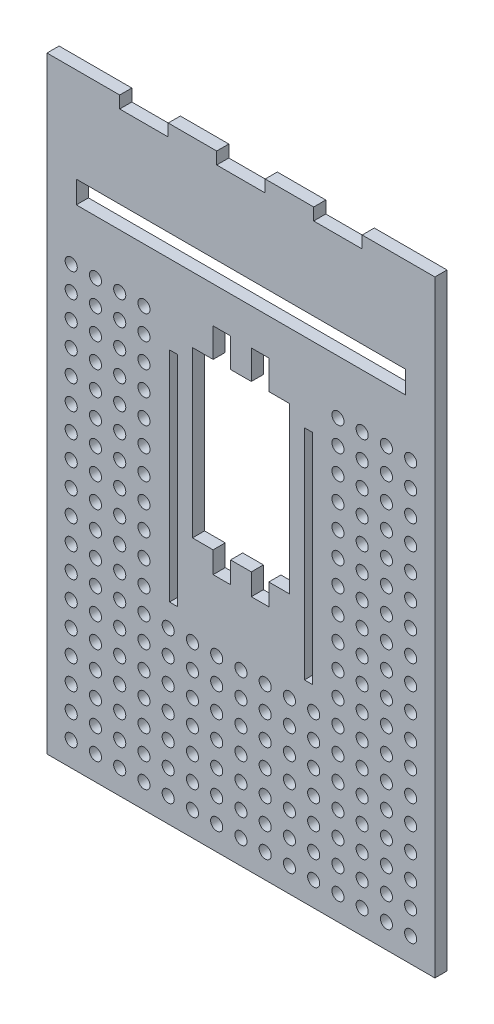
from build123d import *

# Parameters (mm, degrees)
SKETCH1_W           = 101.6
SKETCH1_H           = 159.004
BOSS_EXTRUDE1_DEPTH = 3.175
CUT_EXTRUDE1_REACH  = 96.4
SKETCH3_W           = 25.4
SKETCH3_H           = 43.18
CUT_EXTRUDE2_REACH  = 96.4
SKETCH4_W           = 12.7
SKETCH4_H           = 3.175
CUT_EXTRUDE3_REACH  = 96.4
SKETCH5_W           = 4.572
SKETCH5_H           = 7.62
SKETCH5_H_2         = 5.627437874
CUT_EXTRUDE4_REACH  = 96.4
SKETCH6_W           = 86.234169996
SKETCH6_H           = 5.842
CUT_EXTRUDE5_REACH  = 96.4
SKETCH8_W           = 2.0828
SKETCH8_H           = 57.198896488
SKETCH9_R           = 1.5875
CUT_EXTRUDE6_DEPTH  = 3.175


with BuildPart() as part:
    # Sketch1 → Boss-Extrude1 (new body)
    with BuildSketch(Plane.XY):
        Rectangle(SKETCH1_W, SKETCH1_H)
    extrude(amount=BOSS_EXTRUDE1_DEPTH)

    # Sketch3 → Cut-Extrude1 (cut, up to next)
    with BuildSketch(Plane.XY.offset(3.175), mode=Mode.PRIVATE) as cut_extrude1_sk1:
        with Locations((0, 10.16)):
            Rectangle(SKETCH3_W, SKETCH3_H)
    cut_extrude1_tool1 = extrude(cut_extrude1_sk1.sketch, amount=-CUT_EXTRUDE1_REACH, mode=Mode.PRIVATE) & part.part
    add(cut_extrude1_tool1.solids().sort_by_distance((0, 10.16, 3.175))[0], mode=Mode.SUBTRACT)

    # Sketch4 → Cut-Extrude2 (cut, up to next)
    with BuildSketch(Plane.XY.offset(3.175), mode=Mode.PRIVATE) as cut_extrude2_sk1:
        with Locations((0, 77.9145)):
            Rectangle(SKETCH4_W, SKETCH4_H)
    cut_extrude2_tool1 = extrude(cut_extrude2_sk1.sketch, amount=-CUT_EXTRUDE2_REACH, mode=Mode.PRIVATE) & part.part
    # Sketch4 → Cut-Extrude2 (cut, up to next)
    with BuildSketch(Plane.XY.offset(3.175), mode=Mode.PRIVATE) as cut_extrude2_sk2:
        with Locations((25.4, 77.9145)):
            Rectangle(SKETCH4_W, SKETCH4_H)
    cut_extrude2_tool2 = extrude(cut_extrude2_sk2.sketch, amount=-CUT_EXTRUDE2_REACH, mode=Mode.PRIVATE) & part.part
    # Sketch4 → Cut-Extrude2 (cut, up to next)
    with BuildSketch(Plane.XY.offset(3.175), mode=Mode.PRIVATE) as cut_extrude2_sk3:
        with Locations((-25.4, 77.9145)):
            Rectangle(SKETCH4_W, SKETCH4_H)
    cut_extrude2_tool3 = extrude(cut_extrude2_sk3.sketch, amount=-CUT_EXTRUDE2_REACH, mode=Mode.PRIVATE) & part.part
    add(cut_extrude2_tool1.solids().sort_by_distance((0, 77.9145, 3.175))[0], mode=Mode.SUBTRACT)
    add(cut_extrude2_tool2.solids().sort_by_distance((25.4, 77.9145, 3.175))[0], mode=Mode.SUBTRACT)
    add(cut_extrude2_tool3.solids().sort_by_distance((-25.4, 77.9145, 3.175))[0], mode=Mode.SUBTRACT)

    # Sketch5 → Cut-Extrude3 (cut, up to next)
    with BuildSketch(Plane.XY.offset(3.175), mode=Mode.PRIVATE) as cut_extrude3_sk1:
        with Locations((-5.000000218, 35.56)):
            Rectangle(SKETCH5_W, SKETCH5_H)
    cut_extrude3_tool1 = extrude(cut_extrude3_sk1.sketch, amount=-CUT_EXTRUDE3_REACH, mode=Mode.PRIVATE) & part.part
    # Sketch5 → Cut-Extrude3 (cut, up to next)
    with BuildSketch(Plane.XY.offset(3.175), mode=Mode.PRIVATE) as cut_extrude3_sk2:
        with Locations((5.000000218, 35.56)):
            Rectangle(SKETCH5_W, SKETCH5_H)
    cut_extrude3_tool2 = extrude(cut_extrude3_sk2.sketch, amount=-CUT_EXTRUDE3_REACH, mode=Mode.PRIVATE) & part.part
    # Sketch5 → Cut-Extrude3 (cut, up to next)
    with BuildSketch(Plane.XY.offset(3.175), mode=Mode.PRIVATE) as cut_extrude3_sk3:
        with Locations((-5.000000218, -14.243718937)):
            Rectangle(SKETCH5_W, SKETCH5_H_2)
    cut_extrude3_tool3 = extrude(cut_extrude3_sk3.sketch, amount=-CUT_EXTRUDE3_REACH, mode=Mode.PRIVATE) & part.part
    # Sketch5 → Cut-Extrude3 (cut, up to next)
    with BuildSketch(Plane.XY.offset(3.175), mode=Mode.PRIVATE) as cut_extrude3_sk4:
        with Locations((5.000000218, -14.243718937)):
            Rectangle(SKETCH5_W, SKETCH5_H_2)
    cut_extrude3_tool4 = extrude(cut_extrude3_sk4.sketch, amount=-CUT_EXTRUDE3_REACH, mode=Mode.PRIVATE) & part.part
    add(cut_extrude3_tool1.solids().sort_by_distance((-5, 35.56, 3.175))[0], mode=Mode.SUBTRACT)
    add(cut_extrude3_tool2.solids().sort_by_distance((5, 35.56, 3.175))[0], mode=Mode.SUBTRACT)
    add(cut_extrude3_tool3.solids().sort_by_distance((-5, -14.243719, 3.175))[0], mode=Mode.SUBTRACT)
    add(cut_extrude3_tool4.solids().sort_by_distance((5, -14.243719, 3.175))[0], mode=Mode.SUBTRACT)

    # Sketch6 → Cut-Extrude4 (cut, up to next)
    with BuildSketch(Plane.XY.offset(3.175), mode=Mode.PRIVATE) as cut_extrude4_sk1:
        with Locations((0, 51.816)):
            Rectangle(SKETCH6_W, SKETCH6_H)
    cut_extrude4_tool1 = extrude(cut_extrude4_sk1.sketch, amount=-CUT_EXTRUDE4_REACH, mode=Mode.PRIVATE) & part.part
    add(cut_extrude4_tool1.solids().sort_by_distance((0, 51.816, 3.175))[0], mode=Mode.SUBTRACT)

    # Sketch8 → Cut-Extrude5 (cut, up to next)
    with BuildSketch(Plane.XY.offset(3.175), mode=Mode.PRIVATE) as cut_extrude5_sk1:
        with Locations((-17.665411222, -0.377226022)):
            Rectangle(SKETCH8_W, SKETCH8_H)
    cut_extrude5_tool1 = extrude(cut_extrude5_sk1.sketch, amount=-CUT_EXTRUDE5_REACH, mode=Mode.PRIVATE) & part.part
    # Sketch8 → Cut-Extrude5 (cut, up to next)
    with BuildSketch(Plane.XY.offset(3.175), mode=Mode.PRIVATE) as cut_extrude5_sk2:
        with Locations((17.665411222, -0.377226022)):
            Rectangle(SKETCH8_W, SKETCH8_H)
    cut_extrude5_tool2 = extrude(cut_extrude5_sk2.sketch, amount=-CUT_EXTRUDE5_REACH, mode=Mode.PRIVATE) & part.part
    add(cut_extrude5_tool1.solids().sort_by_distance((-17.665411, -0.377226, 3.175))[0], mode=Mode.SUBTRACT)
    add(cut_extrude5_tool2.solids().sort_by_distance((17.665411, -0.377226, 3.175))[0], mode=Mode.SUBTRACT)

    # Sketch9 → Cut-Extrude6 (cut)
    with BuildSketch(Plane.XY.offset(3.175)):
        with Locations((-44.45, -73.152)):
            Circle(SKETCH9_R)
        with Locations((-38.1, -73.152)):
            Circle(SKETCH9_R)
        with Locations((-31.75, -73.152)):
            Circle(SKETCH9_R)
        with Locations((-25.4, -73.152)):
            Circle(SKETCH9_R)
        with Locations((-19.05, -73.152)):
            Circle(SKETCH9_R)
        with Locations((-12.7, -73.152)):
            Circle(SKETCH9_R)
        with Locations((-6.35, -73.152)):
            Circle(SKETCH9_R)
        with Locations((0, -73.152)):
            Circle(SKETCH9_R)
        with Locations((6.35, -73.152)):
            Circle(SKETCH9_R)
        with Locations((12.7, -73.152)):
            Circle(SKETCH9_R)
        with Locations((19.05, -73.152)):
            Circle(SKETCH9_R)
        with Locations((25.4, -73.152)):
            Circle(SKETCH9_R)
        with Locations((31.75, -73.152)):
            Circle(SKETCH9_R)
        with Locations((38.1, -73.152)):
            Circle(SKETCH9_R)
        with Locations((44.45, -73.152)):
            Circle(SKETCH9_R)
        with Locations((-38.1, -66.802)):
            Circle(SKETCH9_R)
        with Locations((-31.75, -66.802)):
            Circle(SKETCH9_R)
        with Locations((-25.4, -66.802)):
            Circle(SKETCH9_R)
        with Locations((-19.05, -66.802)):
            Circle(SKETCH9_R)
        with Locations((-12.7, -66.802)):
            Circle(SKETCH9_R)
        with Locations((-6.35, -66.802)):
            Circle(SKETCH9_R)
        with Locations((0, -66.802)):
            Circle(SKETCH9_R)
        with Locations((6.35, -66.802)):
            Circle(SKETCH9_R)
        with Locations((12.7, -66.802)):
            Circle(SKETCH9_R)
        with Locations((19.05, -66.802)):
            Circle(SKETCH9_R)
        with Locations((25.4, -66.802)):
            Circle(SKETCH9_R)
        with Locations((31.75, -66.802)):
            Circle(SKETCH9_R)
        with Locations((38.1, -66.802)):
            Circle(SKETCH9_R)
        with Locations((44.45, -66.802)):
            Circle(SKETCH9_R)
        with Locations((-38.1, -60.452)):
            Circle(SKETCH9_R)
        with Locations((-31.75, -60.452)):
            Circle(SKETCH9_R)
        with Locations((-25.4, -60.452)):
            Circle(SKETCH9_R)
        with Locations((-19.05, -60.452)):
            Circle(SKETCH9_R)
        with Locations((-12.7, -60.452)):
            Circle(SKETCH9_R)
        with Locations((-6.35, -60.452)):
            Circle(SKETCH9_R)
        with Locations((0, -60.452)):
            Circle(SKETCH9_R)
        with Locations((6.35, -60.452)):
            Circle(SKETCH9_R)
        with Locations((12.7, -60.452)):
            Circle(SKETCH9_R)
        with Locations((19.05, -60.452)):
            Circle(SKETCH9_R)
        with Locations((25.4, -60.452)):
            Circle(SKETCH9_R)
        with Locations((31.75, -60.452)):
            Circle(SKETCH9_R)
        with Locations((38.1, -60.452)):
            Circle(SKETCH9_R)
        with Locations((44.45, -60.452)):
            Circle(SKETCH9_R)
        with Locations((-38.1, -54.102)):
            Circle(SKETCH9_R)
        with Locations((-31.75, -54.102)):
            Circle(SKETCH9_R)
        with Locations((-25.4, -54.102)):
            Circle(SKETCH9_R)
        with Locations((-19.05, -54.102)):
            Circle(SKETCH9_R)
        with Locations((-12.7, -54.102)):
            Circle(SKETCH9_R)
        with Locations((-6.35, -54.102)):
            Circle(SKETCH9_R)
        with Locations((0, -54.102)):
            Circle(SKETCH9_R)
        with Locations((6.35, -54.102)):
            Circle(SKETCH9_R)
        with Locations((12.7, -54.102)):
            Circle(SKETCH9_R)
        with Locations((19.05, -54.102)):
            Circle(SKETCH9_R)
        with Locations((25.4, -54.102)):
            Circle(SKETCH9_R)
        with Locations((31.75, -54.102)):
            Circle(SKETCH9_R)
        with Locations((38.1, -54.102)):
            Circle(SKETCH9_R)
        with Locations((44.45, -54.102)):
            Circle(SKETCH9_R)
        with Locations((-38.1, -47.752)):
            Circle(SKETCH9_R)
        with Locations((-31.75, -47.752)):
            Circle(SKETCH9_R)
        with Locations((-25.4, -47.752)):
            Circle(SKETCH9_R)
        with Locations((-19.05, -47.752)):
            Circle(SKETCH9_R)
        with Locations((-12.7, -47.752)):
            Circle(SKETCH9_R)
        with Locations((-6.35, -47.752)):
            Circle(SKETCH9_R)
        with Locations((0, -47.752)):
            Circle(SKETCH9_R)
        with Locations((6.35, -47.752)):
            Circle(SKETCH9_R)
        with Locations((12.7, -47.752)):
            Circle(SKETCH9_R)
        with Locations((19.05, -47.752)):
            Circle(SKETCH9_R)
        with Locations((25.4, -47.752)):
            Circle(SKETCH9_R)
        with Locations((31.75, -47.752)):
            Circle(SKETCH9_R)
        with Locations((38.1, -47.752)):
            Circle(SKETCH9_R)
        with Locations((44.45, -47.752)):
            Circle(SKETCH9_R)
        with Locations((-38.1, -41.402)):
            Circle(SKETCH9_R)
        with Locations((-31.75, -41.402)):
            Circle(SKETCH9_R)
        with Locations((-25.4, -41.402)):
            Circle(SKETCH9_R)
        with Locations((-19.05, -41.402)):
            Circle(SKETCH9_R)
        with Locations((-12.7, -41.402)):
            Circle(SKETCH9_R)
        with Locations((-6.35, -41.402)):
            Circle(SKETCH9_R)
        with Locations((0, -41.402)):
            Circle(SKETCH9_R)
        with Locations((6.35, -41.402)):
            Circle(SKETCH9_R)
        with Locations((12.7, -41.402)):
            Circle(SKETCH9_R)
        with Locations((19.05, -41.402)):
            Circle(SKETCH9_R)
        with Locations((25.4, -41.402)):
            Circle(SKETCH9_R)
        with Locations((31.75, -41.402)):
            Circle(SKETCH9_R)
        with Locations((38.1, -41.402)):
            Circle(SKETCH9_R)
        with Locations((44.45, -41.402)):
            Circle(SKETCH9_R)
        with Locations((-38.1, -35.052)):
            Circle(SKETCH9_R)
        with Locations((-31.75, -35.052)):
            Circle(SKETCH9_R)
        with Locations((-25.4, -35.052)):
            Circle(SKETCH9_R)
        with Locations((-19.05, -35.052)):
            Circle(SKETCH9_R)
        with Locations((-12.7, -35.052)):
            Circle(SKETCH9_R)
        with Locations((-6.35, -35.052)):
            Circle(SKETCH9_R)
        with Locations((0, -35.052)):
            Circle(SKETCH9_R)
        with Locations((6.35, -35.052)):
            Circle(SKETCH9_R)
        with Locations((12.7, -35.052)):
            Circle(SKETCH9_R)
        with Locations((19.05, -35.052)):
            Circle(SKETCH9_R)
        with Locations((25.4, -35.052)):
            Circle(SKETCH9_R)
        with Locations((31.75, -35.052)):
            Circle(SKETCH9_R)
        with Locations((38.1, -35.052)):
            Circle(SKETCH9_R)
        with Locations((44.45, -35.052)):
            Circle(SKETCH9_R)
        with Locations((-44.45, -66.802)):
            Circle(SKETCH9_R)
        with Locations((-44.45, -60.452)):
            Circle(SKETCH9_R)
        with Locations((-44.45, -54.102)):
            Circle(SKETCH9_R)
        with Locations((-44.45, -47.752)):
            Circle(SKETCH9_R)
        with Locations((-44.45, -41.402)):
            Circle(SKETCH9_R)
        with Locations((-44.45, -35.052)):
            Circle(SKETCH9_R)
        with Locations((-44.45, -28.702)):
            Circle(SKETCH9_R)
        with Locations((-38.1, -28.702)):
            Circle(SKETCH9_R)
        with Locations((-31.75, -28.702)):
            Circle(SKETCH9_R)
        with Locations((-25.4, -28.702)):
            Circle(SKETCH9_R)
        with Locations((25.4, -28.702)):
            Circle(SKETCH9_R)
        with Locations((31.75, -28.702)):
            Circle(SKETCH9_R)
        with Locations((38.1, -28.702)):
            Circle(SKETCH9_R)
        with Locations((44.45, -28.702)):
            Circle(SKETCH9_R)
        with Locations((-44.45, -22.352)):
            Circle(SKETCH9_R)
        with Locations((-38.1, -22.352)):
            Circle(SKETCH9_R)
        with Locations((-31.75, -22.352)):
            Circle(SKETCH9_R)
        with Locations((-25.4, -22.352)):
            Circle(SKETCH9_R)
        with Locations((25.4, -22.352)):
            Circle(SKETCH9_R)
        with Locations((31.75, -22.352)):
            Circle(SKETCH9_R)
        with Locations((38.1, -22.352)):
            Circle(SKETCH9_R)
        with Locations((44.45, -22.352)):
            Circle(SKETCH9_R)
        with Locations((-44.45, -16.002)):
            Circle(SKETCH9_R)
        with Locations((-38.1, -16.002)):
            Circle(SKETCH9_R)
        with Locations((-31.75, -16.002)):
            Circle(SKETCH9_R)
        with Locations((-25.4, -16.002)):
            Circle(SKETCH9_R)
        with Locations((25.4, -16.002)):
            Circle(SKETCH9_R)
        with Locations((31.75, -16.002)):
            Circle(SKETCH9_R)
        with Locations((38.1, -16.002)):
            Circle(SKETCH9_R)
        with Locations((44.45, -16.002)):
            Circle(SKETCH9_R)
        with Locations((-44.45, -9.652)):
            Circle(SKETCH9_R)
        with Locations((-38.1, -9.652)):
            Circle(SKETCH9_R)
        with Locations((-31.75, -9.652)):
            Circle(SKETCH9_R)
        with Locations((-25.4, -9.652)):
            Circle(SKETCH9_R)
        with Locations((25.4, -9.652)):
            Circle(SKETCH9_R)
        with Locations((31.75, -9.652)):
            Circle(SKETCH9_R)
        with Locations((38.1, -9.652)):
            Circle(SKETCH9_R)
        with Locations((44.45, -9.652)):
            Circle(SKETCH9_R)
        with Locations((-44.45, -3.302)):
            Circle(SKETCH9_R)
        with Locations((-38.1, -3.302)):
            Circle(SKETCH9_R)
        with Locations((-31.75, -3.302)):
            Circle(SKETCH9_R)
        with Locations((-25.4, -3.302)):
            Circle(SKETCH9_R)
        with Locations((25.4, -3.302)):
            Circle(SKETCH9_R)
        with Locations((31.75, -3.302)):
            Circle(SKETCH9_R)
        with Locations((38.1, -3.302)):
            Circle(SKETCH9_R)
        with Locations((44.45, -3.302)):
            Circle(SKETCH9_R)
        with Locations((-44.45, 3.048)):
            Circle(SKETCH9_R)
        with Locations((-38.1, 3.048)):
            Circle(SKETCH9_R)
        with Locations((-31.75, 3.048)):
            Circle(SKETCH9_R)
        with Locations((-25.4, 3.048)):
            Circle(SKETCH9_R)
        with Locations((25.4, 3.048)):
            Circle(SKETCH9_R)
        with Locations((31.75, 3.048)):
            Circle(SKETCH9_R)
        with Locations((38.1, 3.048)):
            Circle(SKETCH9_R)
        with Locations((44.45, 3.048)):
            Circle(SKETCH9_R)
        with Locations((-44.45, 9.398)):
            Circle(SKETCH9_R)
        with Locations((-38.1, 9.398)):
            Circle(SKETCH9_R)
        with Locations((-31.75, 9.398)):
            Circle(SKETCH9_R)
        with Locations((-25.4, 9.398)):
            Circle(SKETCH9_R)
        with Locations((25.4, 9.398)):
            Circle(SKETCH9_R)
        with Locations((31.75, 9.398)):
            Circle(SKETCH9_R)
        with Locations((38.1, 9.398)):
            Circle(SKETCH9_R)
        with Locations((44.45, 9.398)):
            Circle(SKETCH9_R)
        with Locations((-44.45, 15.748)):
            Circle(SKETCH9_R)
        with Locations((-38.1, 15.748)):
            Circle(SKETCH9_R)
        with Locations((-31.75, 15.748)):
            Circle(SKETCH9_R)
        with Locations((-25.4, 15.748)):
            Circle(SKETCH9_R)
        with Locations((25.4, 15.748)):
            Circle(SKETCH9_R)
        with Locations((31.75, 15.748)):
            Circle(SKETCH9_R)
        with Locations((38.1, 15.748)):
            Circle(SKETCH9_R)
        with Locations((44.45, 15.748)):
            Circle(SKETCH9_R)
        with Locations((-44.45, 22.098)):
            Circle(SKETCH9_R)
        with Locations((-38.1, 22.098)):
            Circle(SKETCH9_R)
        with Locations((-31.75, 22.098)):
            Circle(SKETCH9_R)
        with Locations((-25.4, 22.098)):
            Circle(SKETCH9_R)
        with Locations((25.4, 22.098)):
            Circle(SKETCH9_R)
        with Locations((31.75, 22.098)):
            Circle(SKETCH9_R)
        with Locations((38.1, 22.098)):
            Circle(SKETCH9_R)
        with Locations((44.45, 22.098)):
            Circle(SKETCH9_R)
        with Locations((-44.45, 28.448)):
            Circle(SKETCH9_R)
        with Locations((-38.1, 28.448)):
            Circle(SKETCH9_R)
        with Locations((-31.75, 28.448)):
            Circle(SKETCH9_R)
        with Locations((-25.4, 28.448)):
            Circle(SKETCH9_R)
        with Locations((25.4, 28.448)):
            Circle(SKETCH9_R)
        with Locations((31.75, 28.448)):
            Circle(SKETCH9_R)
        with Locations((38.1, 28.448)):
            Circle(SKETCH9_R)
        with Locations((44.45, 28.448)):
            Circle(SKETCH9_R)
        with Locations((-44.45, 34.798)):
            Circle(SKETCH9_R)
        with Locations((-38.1, 34.798)):
            Circle(SKETCH9_R)
        with Locations((-31.75, 34.798)):
            Circle(SKETCH9_R)
        with Locations((-25.4, 34.798)):
            Circle(SKETCH9_R)
        with Locations((25.4, 34.798)):
            Circle(SKETCH9_R)
        with Locations((31.75, 34.798)):
            Circle(SKETCH9_R)
        with Locations((38.1, 34.798)):
            Circle(SKETCH9_R)
        with Locations((44.45, 34.798)):
            Circle(SKETCH9_R)
    extrude(amount=-CUT_EXTRUDE6_DEPTH, mode=Mode.SUBTRACT)


solid = part.part
